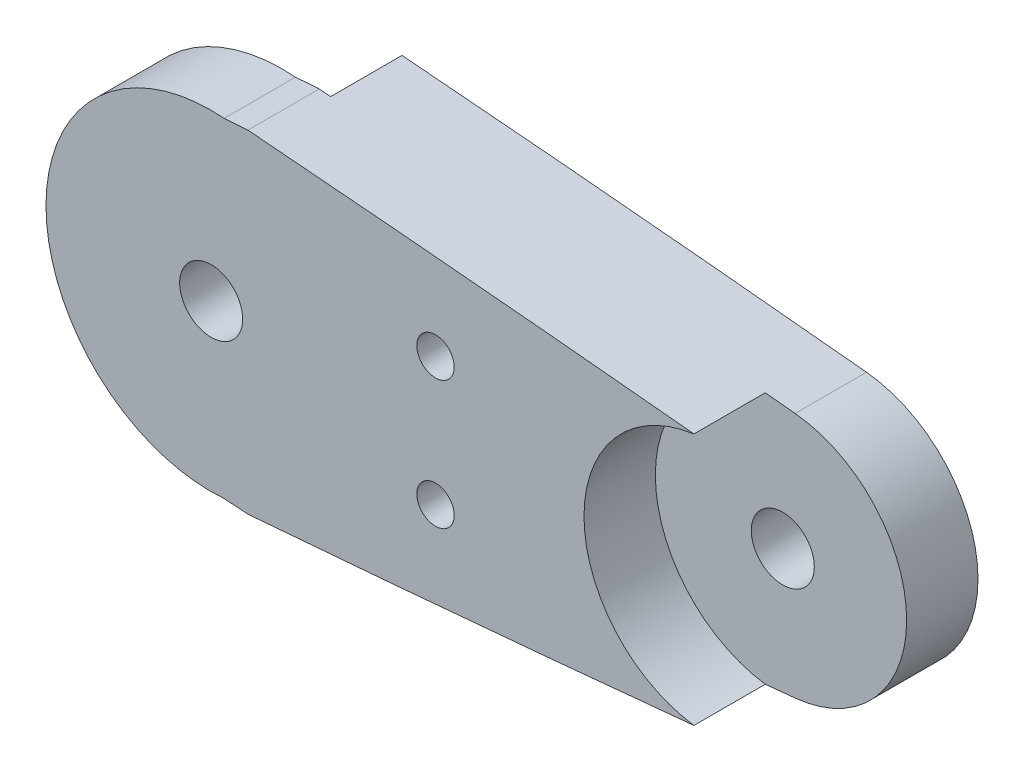
from build123d import *

# Parameters (mm, degrees)
BOSS_EXTRUDE13_START = 6
BOSS_EXTRUDE13_DEPTH = 6
BOSS_EXTRUDE14_DEPTH = 12
SKETCH2_19_R         = 10.418590799
SKETCH2_19_R_2       = 2.65
BOSS_EXTRUDE15_DEPTH = 6
CUT_EXTRUDE1_START   = -6
CUT_EXTRUDE1_DEPTH   = 6
CUT_EXTRUDE2_START   = -12
CUT_EXTRUDE2_DEPTH   = 6
CUT_EXTRUDE4_DEPTH   = 6
SKETCH6_R            = 1.575
CUT_EXTRUDE5_DEPTH   = 227.459741668


# Read off the part's stored shape, not the designer's step: Cut-Extrude2
with BuildPart() as part:
    # Sketch2 → Boss-Extrude13 (new body)
    with BuildSketch(Plane.XY.offset(BOSS_EXTRUDE13_START)):
        with BuildLine():
            ThreePointArc((173.212265813, 14.190949605), (163.177749116, 10.034516697), (159.021316208, 0))
            Line((159.021316208, 0), (170.562265813, 0))
            ThreePointArc((170.562265813, 0), (171.338432843, 1.87383297), (173.212265813, 2.65))
            Line((173.212265813, 2.65), (173.212265813, 14.190949605))
        make_face()
        with BuildLine():
            Line((170.562265813, 0), (159.021316208, 0))
            ThreePointArc((159.021316208, 0), (163.177749116, -10.034516697), (173.212265813, -14.190949605))
            Line((173.212265813, -14.190949605), (173.212265813, -2.65))
            ThreePointArc((173.212265813, -2.65), (171.338432843, -1.87383297), (170.562265813, 0))
        make_face()
        with BuildLine():
            ThreePointArc((187.403215418, 0), (183.634025716, 9.63171694), (174.328689217, 14.146966087))
            ThreePointArc((174.328689217, 14.146966087), (173.77091055, 14.179949462), (173.212265813, 14.190949605))
            Line((173.212265813, 14.190949605), (173.212265813, 2.65))
            ThreePointArc((173.212265813, 2.65), (175.086098783, 1.87383297), (175.862265813, 0))
            Line((175.862265813, 0), (187.403215418, 0))
        make_face()
        with BuildLine():
            ThreePointArc((173.212265813, -14.190949605), (173.77091055, -14.179949462), (174.328689217, -14.146966087))
            ThreePointArc((174.328689217, -14.146966087), (183.634025716, -9.63171694), (187.403215418, 0))
            Line((187.403215418, 0), (175.862265813, 0))
            ThreePointArc((175.862265813, 0), (175.086098783, -1.87383297), (173.212265813, -2.65))
            Line((173.212265813, -2.65), (173.212265813, -14.190949605))
        make_face()
        with BuildLine():
            ThreePointArc((173.212265813, 14.190949605), (163.177749116, 10.034516697), (159.021316208, 0))
            Line((159.021316208, 0), (170.562265813, 0))
            ThreePointArc((170.562265813, 0), (171.338432843, 1.87383297), (173.212265813, 2.65))
            Line((173.212265813, 2.65), (173.212265813, 14.190949605))
        make_face()
        with BuildLine():
            Line((170.562265813, 0), (159.021316208, 0))
            ThreePointArc((159.021316208, 0), (163.177749116, -10.034516697), (173.212265813, -14.190949605))
            Line((173.212265813, -14.190949605), (173.212265813, -2.65))
            ThreePointArc((173.212265813, -2.65), (171.338432843, -1.87383297), (170.562265813, 0))
        make_face()
        with BuildLine():
            ThreePointArc((187.403215418, 0), (183.634025716, 9.63171694), (174.328689217, 14.146966087))
            ThreePointArc((174.328689217, 14.146966087), (173.77091055, 14.179949462), (173.212265813, 14.190949605))
            Line((173.212265813, 14.190949605), (173.212265813, 2.65))
            ThreePointArc((173.212265813, 2.65), (175.086098783, 1.87383297), (175.862265813, 0))
            Line((175.862265813, 0), (187.403215418, 0))
        make_face()
        with BuildLine():
            ThreePointArc((173.212265813, -14.190949605), (173.77091055, -14.179949462), (174.328689217, -14.146966087))
            ThreePointArc((174.328689217, -14.146966087), (183.634025716, -9.63171694), (187.403215418, 0))
            Line((187.403215418, 0), (175.862265813, 0))
            ThreePointArc((175.862265813, 0), (175.086098783, -1.87383297), (173.212265813, -2.65))
            Line((173.212265813, -2.65), (173.212265813, -14.190949605))
        make_face()
    extrude(amount=BOSS_EXTRUDE13_DEPTH)

    # Sketch2<18> → Boss-Extrude14 (add)
    with BuildSketch(Plane.XY):
        with BuildLine():
            add(Edge.make_bspline(
                [(216.328689217, 10.366667201), (213.353925458, 10.66477506), (206.696816501, 11.318389968), (196.26008685, 12.293724806), (185.235415917, 13.263427762), (177.892295007, 13.865740213), (174.328689217, 14.146966087)],
                knots=[0.137765812, 0.137765812, 0.137765812, 0.137765812, 0.152428309, 0.170571841, 0.189174522, 0.206706183, 0.206706183, 0.206706183, 0.206706183], degree=3))
            ThreePointArc((174.328689217, 14.146966087), (183.634025716, 9.63171694), (187.403215418, 0))
            Line((187.403215418, 0), (204.87123106, 0))
            ThreePointArc((204.87123106, 0), (207.922765654, 7.367056204), (215.289821859, 10.418590799))
            ThreePointArc((215.289821859, 10.418590799), (215.809903931, 10.405601803), (216.328689217, 10.366667201))
        make_face()
        with BuildLine():
            ThreePointArc((187.403215418, 0), (183.634025716, -9.63171694), (174.328689217, -14.146966087))
            add(Edge.make_bspline(
                [(174.328689217, -14.146966087), (177.892295007, -13.865740213), (185.235415917, -13.263427762), (196.26008685, -12.293724806), (206.696816501, -11.318389968), (213.353925458, -10.66477506), (216.328689217, -10.366667201)],
                knots=[0.793293817, 0.793293817, 0.793293817, 0.793293817, 0.810825478, 0.829428159, 0.847571691, 0.862234188, 0.862234188, 0.862234188, 0.862234188], degree=3))
            ThreePointArc((216.328689217, -10.366667201), (215.809903931, -10.405601803), (215.289821859, -10.418590799))
            ThreePointArc((215.289821859, -10.418590799), (207.922765654, -7.367056204), (204.87123106, 0))
            Line((204.87123106, 0), (187.403215418, 0))
        make_face()
        with BuildLine():
            add(Edge.make_bspline(
                [(216.328689217, 10.366667201), (213.353925458, 10.66477506), (206.696816501, 11.318389968), (196.26008685, 12.293724806), (185.235415917, 13.263427762), (177.892295007, 13.865740213), (174.328689217, 14.146966087)],
                knots=[0.137765812, 0.137765812, 0.137765812, 0.137765812, 0.152428309, 0.170571841, 0.189174522, 0.206706183, 0.206706183, 0.206706183, 0.206706183], degree=3))
            ThreePointArc((174.328689217, 14.146966087), (183.634025716, 9.63171694), (187.403215418, 0))
            Line((187.403215418, 0), (204.87123106, 0))
            ThreePointArc((204.87123106, 0), (207.922765654, 7.367056204), (215.289821859, 10.418590799))
            ThreePointArc((215.289821859, 10.418590799), (215.809903931, 10.405601803), (216.328689217, 10.366667201))
        make_face()
        with BuildLine():
            ThreePointArc((187.403215418, 0), (183.634025716, -9.63171694), (174.328689217, -14.146966087))
            add(Edge.make_bspline(
                [(174.328689217, -14.146966087), (177.892295007, -13.865740213), (185.235415917, -13.263427762), (196.26008685, -12.293724806), (206.696816501, -11.318389968), (213.353925458, -10.66477506), (216.328689217, -10.366667201)],
                knots=[0.793293817, 0.793293817, 0.793293817, 0.793293817, 0.810825478, 0.829428159, 0.847571691, 0.862234188, 0.862234188, 0.862234188, 0.862234188], degree=3))
            ThreePointArc((216.328689217, -10.366667201), (215.809903931, -10.405601803), (215.289821859, -10.418590799))
            ThreePointArc((215.289821859, -10.418590799), (207.922765654, -7.367056204), (204.87123106, 0))
            Line((204.87123106, 0), (187.403215418, 0))
        make_face()
    extrude(amount=BOSS_EXTRUDE14_DEPTH)

    # Sketch2<19> → Boss-Extrude15 (add)
    with BuildSketch(Plane.XY):
        with Locations((215.289821859, 0)):
            Circle(SKETCH2_19_R)
        with Locations((215.289821859, 0)):
            Circle(SKETCH2_19_R_2, mode=Mode.SUBTRACT)
    extrude(amount=BOSS_EXTRUDE15_DEPTH)

    # Sketch3 → Cut-Extrude1 (cut)
    with BuildSketch(Plane.XY.offset(12).offset(CUT_EXTRUDE1_START)):
        with BuildLine():
            ThreePointArc((174.305087765, -13.847895909), (159.321316208, 0), (174.305087765, 13.847895909))
            Line((174.305087765, 13.847895909), (176.307152097, 13.989700975))
            add(Edge.make_bspline(
                [(176.307152097, 13.989700975), (175.647694257, 14.042496099), (174.988206638, 14.094919544), (174.328689217, 14.146966087)],
                knots=[0.203461594, 0.203461594, 0.203461594, 0.203461594, 0.206706183, 0.206706183, 0.206706183, 0.206706183], degree=3))
            ThreePointArc((174.328689217, 14.146966087), (159.021316208, 0), (174.328689217, -14.146966087))
            add(Edge.make_bspline(
                [(174.328689217, -14.146966087), (174.985934365, -14.095098863), (175.643149915, -14.04285733), (176.300335892, -13.990246656)],
                knots=[0.793293817, 0.793293817, 0.793293817, 0.793293817, 0.796527227, 0.796527227, 0.796527227, 0.796527227], degree=3))
            Line((176.300335892, -13.990246656), (174.305087765, -13.847895909))
        make_face()
        with BuildLine():
            add(Edge.make_bspline(
                [(216.328689217, 10.366667201), (215.491519854, 10.450561851), (214.654303032, 10.533983064), (213.817038746, 10.616925102)],
                knots=[0.137765812, 0.137765812, 0.137765812, 0.137765812, 0.141892188, 0.141892188, 0.141892188, 0.141892188], degree=3))
            ThreePointArc((213.817038746, 10.616925102), (204.57123106, 0), (213.817038746, -10.616925102))
            add(Edge.make_bspline(
                [(213.817038746, -10.616925102), (214.654303032, -10.533983064), (215.491519854, -10.450561851), (216.328689217, -10.366667201)],
                knots=[0.858107812, 0.858107812, 0.858107812, 0.858107812, 0.862234188, 0.862234188, 0.862234188, 0.862234188], degree=3))
            ThreePointArc((216.328689217, -10.366667201), (204.87123106, 0), (216.328689217, 10.366667201))
        make_face()
    extrude(amount=CUT_EXTRUDE1_DEPTH, mode=Mode.SUBTRACT)

    # Cut-Extrude2 outline → Cut-Extrude2 (cut)
    with BuildSketch(Plane.XY.offset(12).offset(CUT_EXTRUDE2_START)):
        with BuildLine():
            ThreePointArc((174.328689217, 14.146966087), (175.06538064, 14.06943553), (175.797022727, 13.953568804))
            Line((175.797022727, 13.953568804), (176.307152091, 13.989700975))
            add(Edge.make_bspline(
                [(176.307152091, 13.989700975), (175.647694253, 14.042496099), (174.988206637, 14.094919544), (174.328689217, 14.146966087)],
                knots=[0.203461594, 0.203461594, 0.203461594, 0.203461594, 0.206706183, 0.206706183, 0.206706183, 0.206706183], degree=3))
        make_face()
        with BuildLine():
            Line((176.300335892, -13.990246656), (175.794024244, -13.95412391))
            ThreePointArc((175.794024244, -13.95412391), (175.063868969, -14.069634552), (174.328689217, -14.146966087))
            add(Edge.make_bspline(
                [(174.328689217, -14.146966087), (174.985934365, -14.095098863), (175.643149916, -14.04285733), (176.300335892, -13.990246656)],
                knots=[0.793293817, 0.793293817, 0.793293817, 0.793293817, 0.796527227, 0.796527227, 0.796527227, 0.796527227], degree=3))
        make_face()
    extrude(amount=CUT_EXTRUDE2_DEPTH, mode=Mode.SUBTRACT)

    # Sketch5 → Cut-Extrude4 (cut)
    with BuildSketch(Plane(origin=(0, 0, 0), x_dir=(-1, 0, 0), z_dir=(0, 0, -1))):
        with BuildLine():
            add(Edge.make_bspline(
                [(-177.264696566, -13.912779214), (-176.943250082, -13.938689614), (-176.621796525, -13.964512296), (-176.300335892, -13.990246656)],
                knots=[0.860652575, 0.860652575, 0.860652575, 0.860652575, 0.862234188, 0.862234188, 0.862234188, 0.862234188], degree=3))
            Line((-176.300335892, -13.990246656), (-175.794024244, -13.95412391))
            ThreePointArc((-175.794024244, -13.95412391), (-187.403215336, -0.001524716), (-175.797022727, 13.953568805))
            Line((-175.797022727, 13.953568805), (-176.307152091, 13.989700975))
            add(Edge.make_bspline(
                [(-176.307152091, 13.989700975), (-176.626340558, 13.964147265), (-176.945522049, 13.93850648), (-177.264696566, 13.912779214)],
                knots=[0.137765812, 0.137765812, 0.137765812, 0.137765812, 0.139336246, 0.139336246, 0.139336246, 0.139336246], degree=3))
            ThreePointArc((-177.264696566, 13.912779214), (-187.703215418, 0), (-177.264696566, -13.912779214))
        make_face()
    extrude(amount=-CUT_EXTRUDE4_DEPTH, mode=Mode.SUBTRACT)

    # Sketch6 → Cut-Extrude5 (cut, through all)
    with BuildSketch(Plane.XY.offset(12)):
        with Locations((192.082086145, 5.4)):
            Circle(SKETCH6_R)
        with Locations((192.082086145, -5.4)):
            Circle(SKETCH6_R)
    extrude(amount=-CUT_EXTRUDE5_DEPTH, mode=Mode.SUBTRACT)


solid = part.part
